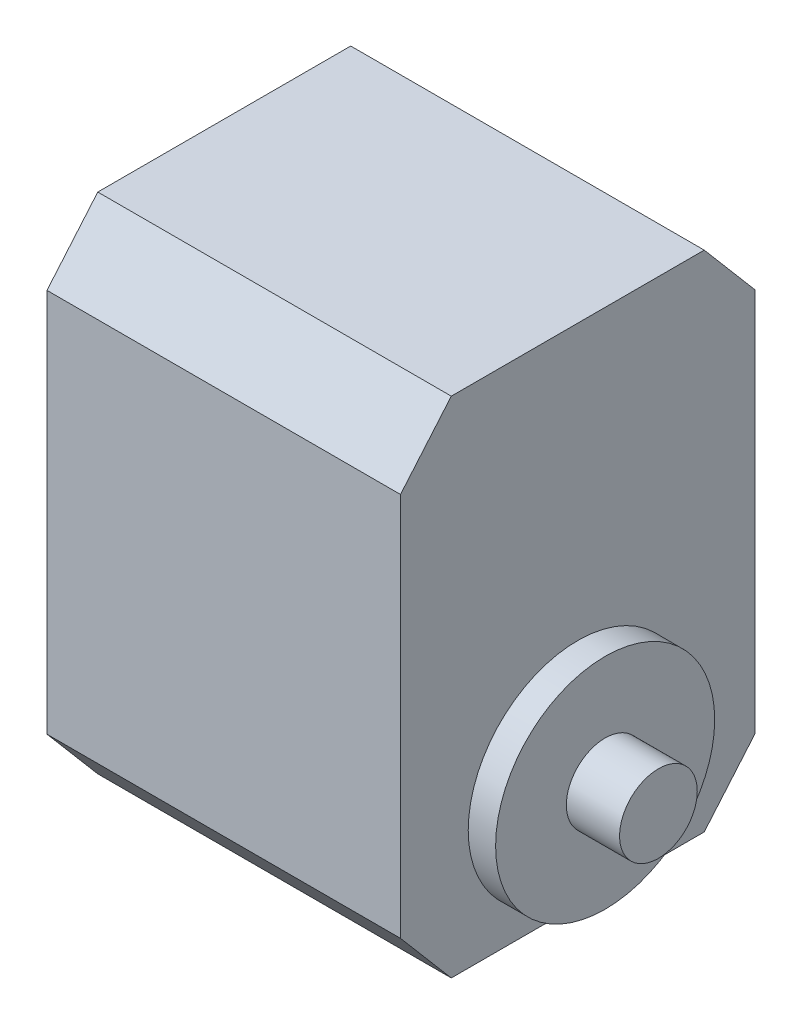
from build123d import *
from OCP.BRepFilletAPI import BRepFilletAPI_MakeChamfer

# Parameters (mm, degrees)
SKETCH2_W           = 35.5
SKETCH2_H           = 35.6
BOSS_EXTRUDE1_DEPTH = 50.6
SKETCH3_R           = 11
BOSS_EXTRUDE2_DEPTH = 2.75
SKETCH4_R           = 3.9
BOSS_EXTRUDE3_DEPTH = 5.35
CHAMFER1_SIZE       = 6
CHAMFER1_SIZE2      = 5.1
MIRROR3_START       = -17.75
MIRROR3_DEPTH       = 35.5


# Read off the part's stored shape, not the designer's step: Mirror3
with BuildPart() as part:
    # Sketch2 → Boss-Extrude1 (new body)
    with BuildSketch(Plane(origin=(0, -12, 0), x_dir=(-1, 0, 0), z_dir=(0, 1, 0))):
        Rectangle(SKETCH2_W, SKETCH2_H)
    extrude(amount=BOSS_EXTRUDE1_DEPTH)

    # Sketch3 → Boss-Extrude2 (add)
    with BuildSketch(Plane(origin=(17.75, 0, 0), x_dir=(0, 0, -1), z_dir=(1, 0, 0))):
        with Locations(Location((0, 0, 0), (0, 0, 180))):
            Circle(SKETCH3_R)
    boss_extrude2 = extrude(amount=BOSS_EXTRUDE2_DEPTH)

    # Sketch4 → Boss-Extrude3 (add)
    with BuildSketch(Plane(origin=(20.5, 0, 0), x_dir=(0, 0, -1), z_dir=(1, 0, 0))):
        Circle(SKETCH4_R)
    boss_extrude3 = extrude(amount=BOSS_EXTRUDE3_DEPTH)

    # Chamfer1: one chamfer whose edges measure the first distance from different faces: ONE call of the kernel's chamfer builder (chamfer() names one face for all edges)
    chamfer1_edges_1 = [part.edges().sort_by_distance(p)[0] for p in [
        (0, 38.6, -17.8),
    ]]
    chamfer1_side_1 = [part.faces().sort_by_distance(p)[0] for p in [
        (0, 13.3, -17.8),
    ]]
    chamfer1_edges_2 = [part.edges().sort_by_distance(p)[0] for p in [
        (0, 38.6, 17.8),
    ]]
    chamfer1_side_2 = [part.faces().sort_by_distance(p)[0] for p in [
        (0, 13.3, 17.8),
    ]]
    chamfer1 = BRepFilletAPI_MakeChamfer(part.part.solid().wrapped)
    for e in chamfer1_edges_1:
        chamfer1.Add(CHAMFER1_SIZE, CHAMFER1_SIZE2, e.wrapped, chamfer1_side_1[0].wrapped)  # the first distance lies on this face
    for e in chamfer1_edges_2:
        chamfer1.Add(CHAMFER1_SIZE, CHAMFER1_SIZE2, e.wrapped, chamfer1_side_2[0].wrapped)  # the first distance lies on this face
    add(Compound.cast(chamfer1.Shape()), mode=Mode.REPLACE)

    # Mirror1: Boss-Extrude2, Boss-Extrude3 across plane
    add(boss_extrude2.mirror(Plane(origin=(0, 0, 0), x_dir=(0, 0, 1), z_dir=(1, 0, 0))))
    add(boss_extrude3.mirror(Plane(origin=(0, 0, 0), x_dir=(0, 0, 1), z_dir=(1, 0, 0))))

    # Mirror3 outline → Mirror3 (cut)
    with BuildSketch(Plane.YZ.offset(MIRROR3_START)):
        Polygon((-6, -17.8), (-12, -12.7), (-12, -17.8), align=None)
        Polygon((-12, 12.7), (-6, 17.8), (-12, 17.8), align=None)
    extrude(amount=MIRROR3_DEPTH, mode=Mode.SUBTRACT)


solid = part.part
